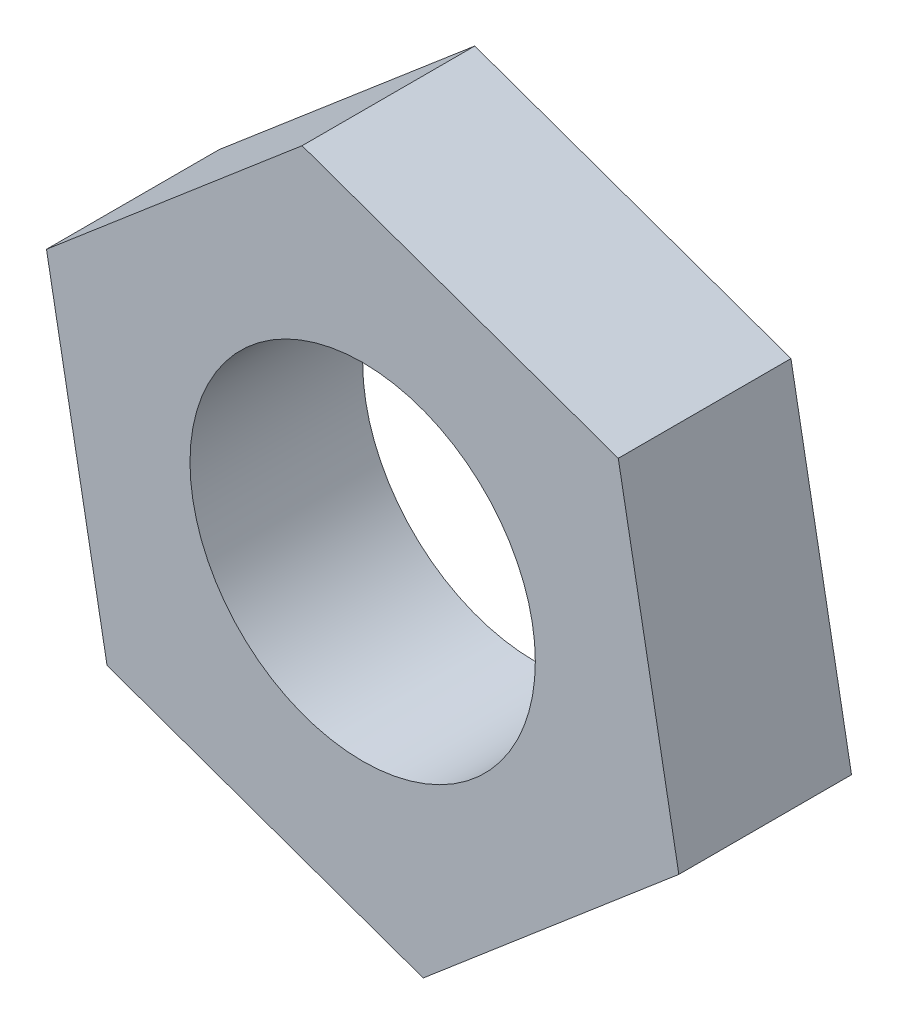
from build123d import *

# Parameters (mm, degrees)
SKETCH1_R           = 3
BOSS_EXTRUDE1_DEPTH = 3


with BuildPart() as part:
    # Sketch1 → Boss-Extrude1 (new body)
    with BuildSketch(Plane.XY):
        Polygon((1324.499074459, -1696.921787568), (1328.940142149, -1693.142887113), (1327.888052202, -1687.407359446), (1322.394894565, -1685.450732233), (1317.953826874, -1689.229632688), (1319.005916822, -1694.965160355), align=None)
        with Locations((1323.446984512, -1691.186259901)):
            Circle(SKETCH1_R, mode=Mode.SUBTRACT)
    extrude(amount=BOSS_EXTRUDE1_DEPTH)


solid = part.part
